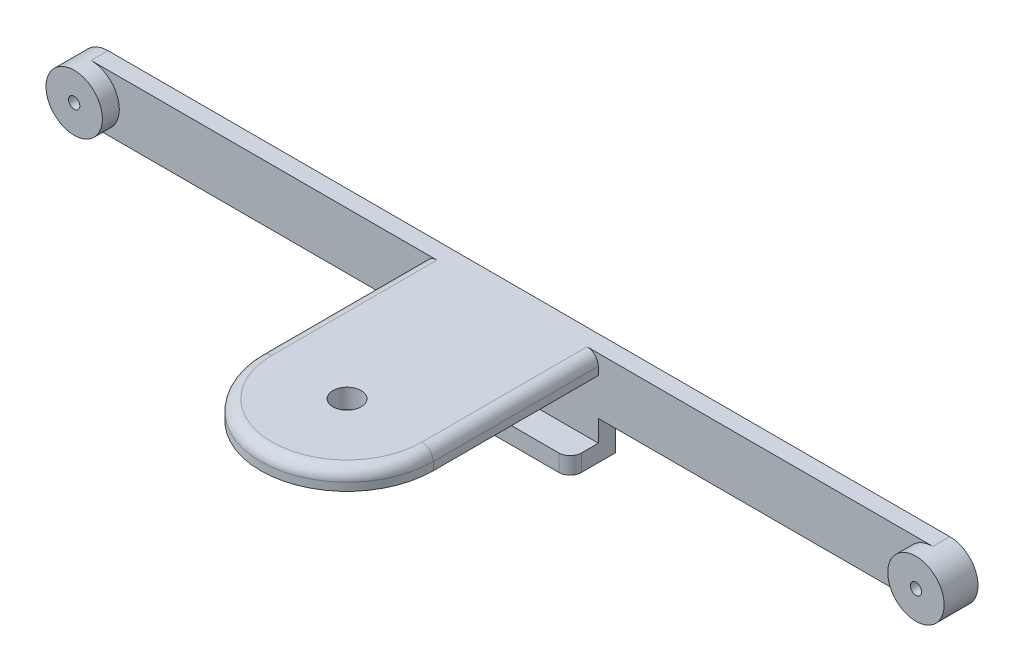
from build123d import *

# Parameters (mm, degrees)
BOSS_EXTRUDE1_DEPTH = 3
SKETCH2_R           = 5
SKETCH2_R_2         = 1
BOSS_EXTRUDE2_DEPTH = 3
CUT_EXTRUDE1_START  = -10
SKETCH7_R           = 1
CUT_EXTRUDE1_DEPTH  = 10
CUT_EXTRUDE2_START  = -10
SKETCH8_R           = 1
CUT_EXTRUDE2_DEPTH  = 10
SKETCH5_R           = 2.5
BOSS_EXTRUDE3_DEPTH = 3.41
SKETCH9_W           = 30.62
SKETCH9_H           = 3
BOSS_EXTRUDE4_DEPTH = 3.8
SKETCH10_W          = 30.62
SKETCH10_H          = 8
BOSS_EXTRUDE5_DEPTH = 3
FILLET3_R           = 2


with BuildPart() as part:
    # Sketch1 → Boss-Extrude1 (new body)
    with BuildSketch(Plane.XY):
        with BuildLine():
            Line((-64.206162528, 9.215011287), (85.023837472, 9.215011287))
            ThreePointArc((85.023837472, 9.215011287), (90.023837472, 4.215011287), (85.023837472, -0.784988713))
            Line((85.023837472, -0.784988713), (-64.206162528, -0.784988713))
            ThreePointArc((-64.206162528, -0.784988713), (-69.206162528, 4.215011287), (-64.206162528, 9.215011287))
        make_face()
    extrude(amount=BOSS_EXTRUDE1_DEPTH)

    # Sketch2 → Boss-Extrude2 (add)
    # profile 1 of 2: a face of its own
    with BuildSketch(Plane.XY.offset(3)):
        with Locations(Location((-64.206162528, 4.215011287, 0), (0, 0, 270))):
            Circle(SKETCH2_R)
        with Locations((-64.206162528, 4.215011287)):
            Circle(SKETCH2_R_2, mode=Mode.SUBTRACT)
    # profile 2 of 2: a face of its own
    with BuildSketch(Plane.XY.offset(3)):
        with Locations(Location((85.023837472, 4.215011287, 0), (0, 0, 90))):
            Circle(SKETCH2_R)
        with Locations((85.023837472, 4.215011287)):
            Circle(SKETCH2_R_2, mode=Mode.SUBTRACT)
    extrude(amount=BOSS_EXTRUDE2_DEPTH)

    # Sketch7 → Cut-Extrude1 (cut)
    with BuildSketch(Plane.XY.offset(6).offset(CUT_EXTRUDE1_START)):
        with Locations((-64.206162528, 4.215011287)):
            Circle(SKETCH7_R)
    extrude(amount=CUT_EXTRUDE1_DEPTH, mode=Mode.SUBTRACT)

    # Sketch8 → Cut-Extrude2 (cut)
    with BuildSketch(Plane.XY.offset(6).offset(CUT_EXTRUDE2_START)):
        with Locations((85.023837472, 4.215011287)):
            Circle(SKETCH8_R)
    extrude(amount=CUT_EXTRUDE2_DEPTH, mode=Mode.SUBTRACT)

    # Sketch5 → Boss-Extrude3 (add)
    with BuildSketch(Plane(origin=(0, 9.215011287, 0), x_dir=(1, 0, 0), z_dir=(0, 1, 0))):
        with BuildLine():
            Line((-4.901162528, -3), (25.718837472, -3))
            Line((25.718837472, -3), (25.718837472, -16.94))
            Line((25.718837472, -16.94), (25.718837472, -32.25))
            ThreePointArc((25.718837472, -32.25), (10.408837472, -47.56), (-4.901162528, -32.25))
            Line((-4.901162528, -32.25), (-4.901162528, -16.94))
            Line((-4.901162528, -16.94), (-4.901162528, -3))
        make_face()
        with Locations(Location((10.408837472, -32.25, 0), (0, 0, 270))):
            Circle(SKETCH5_R, mode=Mode.SUBTRACT)
    extrude(amount=-BOSS_EXTRUDE3_DEPTH)

    # Sketch9 → Boss-Extrude4 (add)
    with BuildSketch(Plane.XZ.offset(0.784988713)):
        with Locations((10.408837472, 1.5)):
            Rectangle(SKETCH9_W, SKETCH9_H)
    extrude(amount=BOSS_EXTRUDE4_DEPTH)

    # Sketch10 → Boss-Extrude5 (add)
    with BuildSketch(Plane.XZ.offset(4.584988713)):
        with Locations((10.408837472, 4)):
            Rectangle(SKETCH10_W, SKETCH10_H)
    extrude(amount=BOSS_EXTRUDE5_DEPTH)

    # Fillet3
    # the kernel refuses this fillet: 2 mm, written as the material it takes off along each edge
    with BuildSketch(Plane(origin=(25.718837472, 9.215011287, 3), x_dir=(-1, 0, 0), z_dir=(0, 0, 1)), Plane(origin=(-4.901162528, 9.215011287, 32.25), x_dir=(1, 0, 0), z_dir=(0, 0, -1))) as fillet3_piece_1:
        with BuildLine():
            CenterArc((FILLET3_R, FILLET3_R), FILLET3_R, 180, 90)
            Line((0, FILLET3_R), (0, 0))
            Line((0, 0), (FILLET3_R, 0))
        make_face()
    extrude(amount=29.25, mode=Mode.SUBTRACT)
    with BuildSketch(Plane(origin=(10.408837472, 9.215011287, 32.25), x_dir=(1, 0, 0), z_dir=(0, 0, -1))) as fillet3_piece_2:
        with BuildLine():
            CenterArc((15.31 - FILLET3_R, FILLET3_R), FILLET3_R, 270, 90)
            Line((15.31, FILLET3_R), (15.31, 0))
            Line((15.31, 0), (15.31 - FILLET3_R, 0))
        make_face()
    revolve(axis=Axis((10.408837472, 9.215011287, 32.25), (0, -1, 0)), revolution_arc=180, mode=Mode.SUBTRACT)
    with BuildSketch(Plane(origin=(-4.901162528, 0.415011287, 8), x_dir=(0, 0, -1), z_dir=(0, -1, 0)), Plane(origin=(25.718837472, 0.415011287, 8), x_dir=(-1, 0, 0), z_dir=(0, -1, 0))) as fillet3_piece_3:
        with BuildLine():
            CenterArc((FILLET3_R, FILLET3_R), FILLET3_R, 180, 90)
            Line((0, FILLET3_R), (0, 0))
            Line((0, 0), (FILLET3_R, 0))
        make_face()
    extrude(amount=13, mode=Mode.SUBTRACT)


solid = part.part
